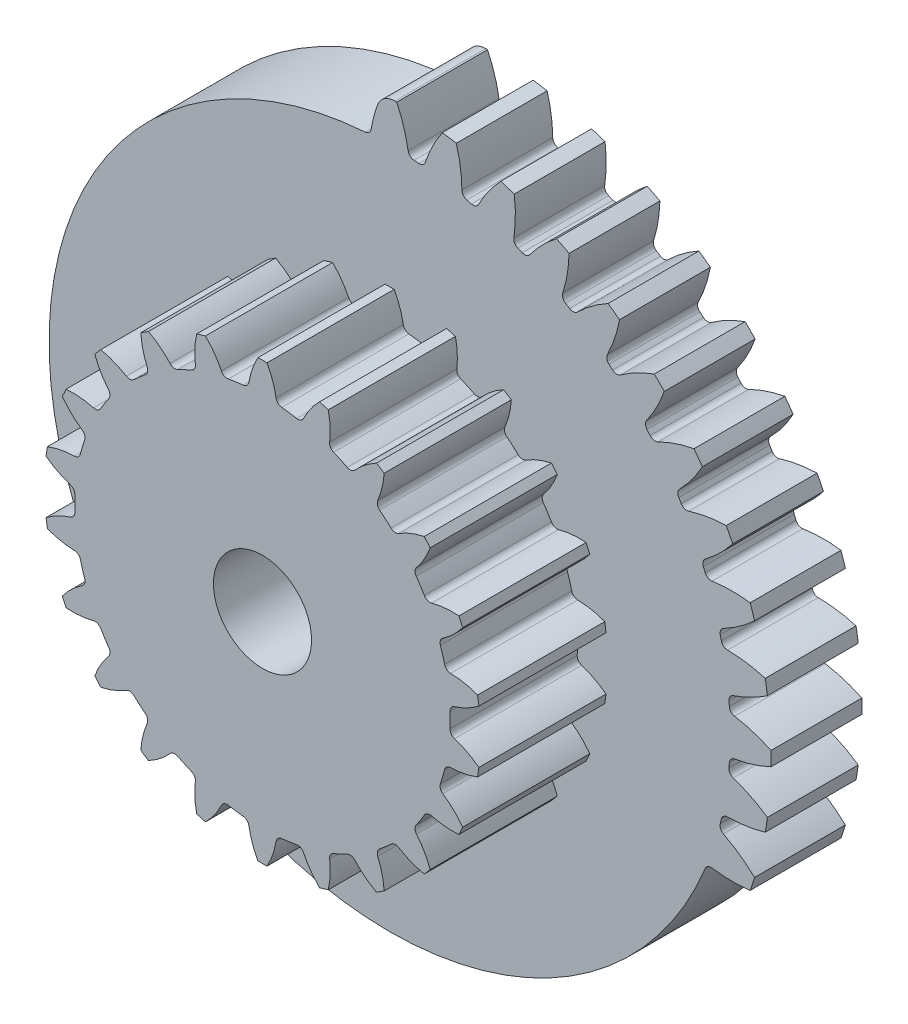
from build123d import *
from build123d.topology import SkipClean

# Parameters (mm, degrees)
ESQUISSE1_R                        = 1.15
BASE_EXTRUSION_DEPTH               = 2.5
BOSS_EXTRU_1_DEPTH                 = 5
CONG_1_R                           = 0.35
R_P_TITION_CIRCULAIRE4_COUNT       = 13
R_P_TITION_CIRCULAIRE4_ANGLE       = 108
CONG_1_OF_R_P_TITION_CIRCULAIRE4_R = 0.35
ENL_V_MAT_EXTRU_1_DEPTH            = 31.116440849
ENL_V_MAT_EXTRU_1_DEPTH_BACK       = 31.116440849
ESQUISSE4_R                        = 2.7
CONG_2_R                           = 1
BOSS_EXTRU_2_DEPTH                 = 5
BOSS_EXTRU_3_DEPTH                 = 7
R_P_TITION_START                   = 5
R_P_TITION_CIRCULAIRE6_DEPTH       = 7
ENL_V_MAT_EXTRU_2_REACH            = 32.511
ESQUISSE7_R                        = 2.7


# Read off the part's stored shape, not the designer's step: Répétition circulaire6
with BuildPart() as part:
    # Esquisse1 → Base-Extrusion (new body)
    with BuildSketch(Plane.XY):
        Circle(ESQUISSE1_R)
    extrude(amount=BASE_EXTRUSION_DEPTH)

    # Esquisse3 → Boss.-Extru.1 (add)
    with BuildSketch(Plane.XY):
        with BuildLine():
            Line((-1.6, 18.681608603), (0, 0))
            Line((0, 0), (1.6, 18.681608603))
            ThreePointArc((1.6, 18.681608603), (1.330138614, 18.702759991), (1.06, 18.720013355))
            ThreePointArc((1.06, 18.720013355), (0.815144271, 19.884727872), (0.39, 20.996378259))
            ThreePointArc((0.39, 20.996378259), (0, 21), (-0.39, 20.996378259))
            ThreePointArc((-0.39, 20.996378259), (-0.815144271, 19.884727872), (-1.06, 18.720013355))
            ThreePointArc((-1.06, 18.720013355), (-1.330138614, 18.702759991), (-1.6, 18.681608603))
        make_face()
    boss_extru_1 = extrude(amount=BOSS_EXTRU_1_DEPTH)

    # Congé1
    cong_1_edges = [part.edges().sort_by_distance(p)[0] for p in [
        (1.06, 18.720013355, 2.5),
        (-1.06, 18.720013355, 2.5),
    ]]
    fillet(cong_1_edges, radius=CONG_1_R)

    # Répétition circulaire4: Boss.-Extru.1 ×13 about axis
    r_p_tition_circulaire4_axis = Axis((0, 0, 0), (0, 0, -1))
    for i in range(1, R_P_TITION_CIRCULAIRE4_COUNT):
        add(boss_extru_1.rotate(r_p_tition_circulaire4_axis, i * R_P_TITION_CIRCULAIRE4_ANGLE / (R_P_TITION_CIRCULAIRE4_COUNT - 1)))

    # Congé1 of Répétition circulaire4
    cong_1_of_r_p_tition_circulaire4_edges = [part.edges().sort_by_distance(p)[0] for p in [
        (3.975404916, 18.323718393, 2.5),
        (1.881505634, 18.655359459, 2.5),
        (6.792922169, 17.476232672, 2.5),
        (4.776682354, 18.1313487, 2.5),
        (9.443175134, 16.198424102, 2.5),
        (7.554241302, 17.160883962, 2.5),
        (11.860905787, 14.521756571, 2.5),
        (10.145789759, 15.767861306, 2.5),
        (13.986581575, 12.487515199, 2.5),
        (12.487515199, 13.986581575, 2.5),
        (15.767861306, 10.145789759, 2.5),
        (14.521756571, 11.860905787, 2.5),
        (17.160883962, 7.554241302, 2.5),
        (16.198424102, 9.443175134, 2.5),
        (18.1313487, 4.776682354, 2.5),
        (17.476232672, 6.792922169, 2.5),
        (18.655359459, 1.881505634, 2.5),
        (18.323718393, 3.975404916, 2.5),
        (18.720013355, -1.06, 2.5),
        (18.720013355, 1.06, 2.5),
        (18.323718393, -3.975404916, 2.5),
        (18.655359459, -1.881505634, 2.5),
        (17.476232672, -6.792922169, 2.5),
        (18.1313487, -4.776682354, 2.5),
    ]]
    fillet(cong_1_of_r_p_tition_circulaire4_edges, radius=CONG_1_OF_R_P_TITION_CIRCULAIRE4_R)

    # Esquisse4 → Enlèv. mat.-Extru.1 (cut, two sides: drawn at the far end of the back side and taken through both)
    with BuildSketch(Plane.XY.offset(5).offset(-ENL_V_MAT_EXTRU_1_DEPTH_BACK)):
        Circle(ESQUISSE4_R)
    extrude(amount=ENL_V_MAT_EXTRU_1_DEPTH + ENL_V_MAT_EXTRU_1_DEPTH_BACK, mode=Mode.SUBTRACT)

    # Congé2
    cong_2_edges = [part.edges().sort_by_distance(p)[0] for p in [
        (-0.39, 20.996378259, 2.5),
    ]]
    fillet(cong_2_edges, radius=CONG_2_R)

    # Esquisse5 → Boss.-Extru.2 (add)
    with SkipClean():  # the faces are left unmerged after this step: merging them gives an invalid solid
        with BuildSketch(Plane(origin=(0, 0, 0), x_dir=(-1, 0, 0), z_dir=(0, 0, -1))):
            with BuildLine():
                Line((1.6, 18.681608603), (0.2304, 2.690151639))
                ThreePointArc((0.2304, 2.690151639), (2.184345885, -1.587020181), (-2.48728873, -1.050425995))
                Line((-2.48728873, -1.050425995), (-17.272838406, -7.294624967))
                ThreePointArc((-17.272838406, -7.294624967), (15.169068645, -11.02097348), (1.6, 18.681608603))
            make_face()
        extrude(amount=-BOSS_EXTRU_2_DEPTH)

    # Esquisse6 → Boss.-Extru.3 (add)
    with BuildSketch(Plane.XY.offset(5)):
        with BuildLine():
            Line((2.755166595, 9.960988005), (0, 0))
            Line((0, 0), (-1.282491053, 10.25511783))
            ThreePointArc((-1.282491053, 10.25511783), (-1.170717424, 10.268478257), (-1.058804905, 10.280620466))
            ThreePointArc((-1.058804905, 10.280620466), (-0.854826705, 10.373868903), (-0.749332414, 10.571791442))
            ThreePointArc((-0.749332414, 10.571791442), (-0.561514558, 11.307519234), (-0.25, 12))
            Line((-0.25, 12), (0.25, 12))
            ThreePointArc((0.25, 12), (0.561514558, 11.307519234), (0.749332414, 10.571791442))
            ThreePointArc((0.749332414, 10.571791442), (0.854826705, 10.373868903), (1.058804905, 10.280620466))
            ThreePointArc((1.058804905, 10.280620466), (1.913670786, 10.156283234), (2.755166595, 9.960988005))
        make_face()
    extrude(amount=BOSS_EXTRU_3_DEPTH)

    # Répétition circulaire6 outline → Répétition circulaire6 (add)
    with BuildSketch(Plane.XY.offset(R_P_TITION_START)):
        with BuildLine():
            ThreePointArc((-1.282491053, 10.25511783), (-1.582158452, 10.213177744), (-1.880469623, 10.162482915))
            ThreePointArc((-1.880469623, 10.162482915), (-2.102456393, 10.194486835), (-2.259438648, 10.354670944))
            ThreePointArc((-2.259438648, 10.354670944), (-2.646927032, 11.007682187), (-3.140917439, 11.584348823))
            Line((-3.140917439, 11.584348823), (-3.620663926, 11.443482544))
            ThreePointArc((-3.620663926, 11.443482544), (-3.724465579, 10.691288322), (-3.697397019, 9.93244827))
            ThreePointArc((-3.697397019, 9.93244827), (-3.742856827, 9.712821808), (-3.912301357, 9.565883289))
            ThreePointArc((-3.912301357, 9.565883289), (-4.293314159, 9.401046672), (-4.667399686, 9.221041436))
            ThreePointArc((-4.667399686, 9.221041436), (-4.889410978, 9.189208072), (-5.085163427, 9.298676587))
            ThreePointArc((-5.085163427, 9.298676587), (-5.640930336, 9.816068193), (-6.277376426, 10.230202598))
            Line((-6.277376426, 10.230202598), (-6.698003193, 9.95988219))
            ThreePointArc((-6.698003193, 9.95988219), (-6.585682548, 9.208912814), (-6.345920507, 8.48843721))
            ThreePointArc((-6.345920507, 8.48843721), (-6.327662949, 8.264899655), (-6.44884642, 8.076175138))
            ThreePointArc((-6.44884642, 8.076175138), (-6.767985685, 7.810671851), (-7.076204784, 7.53256602))
            ThreePointArc((-7.076204784, 7.53256602), (-7.280254564, 7.439474322), (-7.498918508, 7.489358755))
            ThreePointArc((-7.498918508, 7.489358755), (-8.177939012, 7.829214733), (-8.905279709, 8.047266201))
            Line((-8.905279709, 8.047266201), (-9.232710076, 7.669391414))
            ThreePointArc((-9.232710076, 7.669391414), (-8.913366684, 6.980485956), (-8.480335257, 6.35674345))
            ThreePointArc((-8.480335257, 6.35674345), (-8.399839451, 6.147404485), (-8.462944299, 5.932183308))
            ThreePointArc((-8.462944299, 5.932183308), (-8.694355262, 5.587522848), (-8.911737855, 5.233846903))
            ThreePointArc((-8.911737855, 5.233846903), (-9.081295223, 5.087038607), (-9.305155809, 5.073297618))
            ThreePointArc((-9.305155809, 5.073297618), (-10.052419706, 5.208084858), (-10.811730191, 5.212388155))
            Line((-10.811730191, 5.212388155), (-11.019437698, 4.757572157))
            ThreePointArc((-11.019437698, 4.757572157), (-10.518942861, 4.186541641), (-9.927723678, 3.710064141))
            ThreePointArc((-9.927723678, 3.710064141), (-9.791510916, 3.531883164), (-9.791424762, 3.307601266))
            ThreePointArc((-9.791424762, 3.307601266), (-9.916359882, 2.911705975), (-10.025294925, 2.511112637))
            ThreePointArc((-10.025294925, 2.511112637), (-10.146623351, 2.322481277), (-10.357544727, 2.246228079))
            ThreePointArc((-10.357544727, 2.246228079), (-11.112513139, 2.165026921), (-11.842278593, 1.95523342))
            Line((-11.842278593, 1.95523342), (-11.913436012, 1.460322699))
            ThreePointArc((-11.913436012, 1.460322699), (-11.272336846, 1.053428621), (-10.570826969, 0.762817499))
            ThreePointArc((-10.570826969, 0.762817499), (-10.3899324, 0.630229673), (-10.326662222, 0.415057041))
            ThreePointArc((-10.326662222, 0.415057041), (-10.335, 0), (-10.326662222, -0.415057041))
            ThreePointArc((-10.326662222, -0.415057041), (-10.3899324, -0.630229673), (-10.570826969, -0.762817499))
            ThreePointArc((-10.570826969, -0.762817499), (-11.272336846, -1.053428621), (-11.913436012, -1.460322699))
            Line((-11.913436012, -1.460322699), (-11.842278593, -1.95523342))
            ThreePointArc((-11.842278593, -1.95523342), (-11.112513139, -2.165026921), (-10.357544727, -2.246228079))
            ThreePointArc((-10.357544727, -2.246228079), (-10.146623351, -2.322481277), (-10.025294925, -2.511112637))
            ThreePointArc((-10.025294925, -2.511112637), (-9.916359882, -2.911705975), (-9.791424762, -3.307601266))
            ThreePointArc((-9.791424762, -3.307601266), (-9.791510916, -3.531883164), (-9.927723678, -3.710064141))
            ThreePointArc((-9.927723678, -3.710064141), (-10.518942861, -4.186541641), (-11.019437698, -4.757572157))
            Line((-11.019437698, -4.757572157), (-10.811730191, -5.212388155))
            ThreePointArc((-10.811730191, -5.212388155), (-10.052419706, -5.208084858), (-9.305155809, -5.073297618))
            ThreePointArc((-9.305155809, -5.073297618), (-9.081295223, -5.087038607), (-8.911737855, -5.233846903))
            ThreePointArc((-8.911737855, -5.233846903), (-8.694355262, -5.587522848), (-8.462944299, -5.932183308))
            ThreePointArc((-8.462944299, -5.932183308), (-8.399839451, -6.147404485), (-8.480335257, -6.35674345))
            ThreePointArc((-8.480335257, -6.35674345), (-8.913366684, -6.980485956), (-9.232710076, -7.669391414))
            Line((-9.232710076, -7.669391414), (-8.905279709, -8.047266201))
            ThreePointArc((-8.905279709, -8.047266201), (-8.177939012, -7.829214733), (-7.498918508, -7.489358755))
            ThreePointArc((-7.498918508, -7.489358755), (-7.280254564, -7.439474322), (-7.076204784, -7.53256602))
            ThreePointArc((-7.076204784, -7.53256602), (-6.767985685, -7.810671851), (-6.44884642, -8.076175138))
            ThreePointArc((-6.44884642, -8.076175138), (-6.327662949, -8.264899655), (-6.345920507, -8.48843721))
            ThreePointArc((-6.345920507, -8.48843721), (-6.585682548, -9.208912814), (-6.698003193, -9.95988219))
            Line((-6.698003193, -9.95988219), (-6.277376426, -10.230202598))
            ThreePointArc((-6.277376426, -10.230202598), (-5.640930336, -9.816068193), (-5.085163427, -9.298676587))
            ThreePointArc((-5.085163427, -9.298676587), (-4.889410978, -9.189208072), (-4.667399686, -9.221041436))
            ThreePointArc((-4.667399686, -9.221041436), (-4.293314159, -9.401046672), (-3.912301357, -9.565883289))
            ThreePointArc((-3.912301357, -9.565883289), (-3.742856827, -9.712821808), (-3.697397019, -9.93244827))
            ThreePointArc((-3.697397019, -9.93244827), (-3.724465579, -10.691288322), (-3.620663926, -11.443482544))
            Line((-3.620663926, -11.443482544), (-3.140917439, -11.584348823))
            ThreePointArc((-3.140917439, -11.584348823), (-2.646927032, -11.007682187), (-2.259438648, -10.354670944))
            ThreePointArc((-2.259438648, -10.354670944), (-2.102456393, -10.194486835), (-1.880469623, -10.162482915))
            ThreePointArc((-1.880469623, -10.162482915), (-1.470823854, -10.229804602), (-1.058804905, -10.280620466))
            ThreePointArc((-1.058804905, -10.280620466), (-0.854826705, -10.373868903), (-0.749332414, -10.571791442))
            ThreePointArc((-0.749332414, -10.571791442), (-0.561514558, -11.307519234), (-0.25, -12))
            Line((-0.25, -12), (0.25, -12))
            ThreePointArc((0.25, -12), (0.561514558, -11.307519234), (0.749332414, -10.571791442))
            ThreePointArc((0.749332414, -10.571791442), (0.854826705, -10.373868903), (1.058804905, -10.280620466))
            ThreePointArc((1.058804905, -10.280620466), (1.470823854, -10.229804602), (1.880469623, -10.162482915))
            ThreePointArc((1.880469623, -10.162482915), (2.102456393, -10.194486835), (2.259438648, -10.354670944))
            ThreePointArc((2.259438648, -10.354670944), (2.646927032, -11.007682187), (3.140917439, -11.584348823))
            Line((3.140917439, -11.584348823), (3.620663926, -11.443482544))
            ThreePointArc((3.620663926, -11.443482544), (3.724465579, -10.691288322), (3.697397019, -9.93244827))
            ThreePointArc((3.697397019, -9.93244827), (3.742856827, -9.712821808), (3.912301357, -9.565883289))
            ThreePointArc((3.912301357, -9.565883289), (4.293314159, -9.401046672), (4.667399686, -9.221041436))
            ThreePointArc((4.667399686, -9.221041436), (4.889410978, -9.189208072), (5.085163427, -9.298676587))
            ThreePointArc((5.085163427, -9.298676587), (5.640930336, -9.816068193), (6.277376426, -10.230202598))
            Line((6.277376426, -10.230202598), (6.698003193, -9.95988219))
            ThreePointArc((6.698003193, -9.95988219), (6.585682548, -9.208912814), (6.345920507, -8.48843721))
            ThreePointArc((6.345920507, -8.48843721), (6.327662949, -8.264899655), (6.44884642, -8.076175138))
            ThreePointArc((6.44884642, -8.076175138), (6.767985685, -7.810671851), (7.076204784, -7.53256602))
            ThreePointArc((7.076204784, -7.53256602), (7.280254564, -7.439474322), (7.498918508, -7.489358755))
            ThreePointArc((7.498918508, -7.489358755), (8.177939012, -7.829214733), (8.905279709, -8.047266201))
            Line((8.905279709, -8.047266201), (9.232710076, -7.669391414))
            ThreePointArc((9.232710076, -7.669391414), (8.913366684, -6.980485956), (8.480335257, -6.35674345))
            ThreePointArc((8.480335257, -6.35674345), (8.399839451, -6.147404485), (8.462944299, -5.932183308))
            ThreePointArc((8.462944299, -5.932183308), (8.694355262, -5.587522848), (8.911737855, -5.233846903))
            ThreePointArc((8.911737855, -5.233846903), (9.081295223, -5.087038607), (9.305155809, -5.073297618))
            ThreePointArc((9.305155809, -5.073297618), (10.052419706, -5.208084858), (10.811730191, -5.212388155))
            Line((10.811730191, -5.212388155), (11.019437698, -4.757572157))
            ThreePointArc((11.019437698, -4.757572157), (10.518942861, -4.186541641), (9.927723678, -3.710064141))
            ThreePointArc((9.927723678, -3.710064141), (9.791510916, -3.531883164), (9.791424762, -3.307601266))
            ThreePointArc((9.791424762, -3.307601266), (9.916359882, -2.911705975), (10.025294925, -2.511112637))
            ThreePointArc((10.025294925, -2.511112637), (10.146623351, -2.322481277), (10.357544727, -2.246228079))
            ThreePointArc((10.357544727, -2.246228079), (11.112513139, -2.165026921), (11.842278593, -1.95523342))
            Line((11.842278593, -1.95523342), (11.913436012, -1.460322699))
            ThreePointArc((11.913436012, -1.460322699), (11.272336846, -1.053428621), (10.570826969, -0.762817499))
            ThreePointArc((10.570826969, -0.762817499), (10.3899324, -0.630229673), (10.326662222, -0.415057041))
            ThreePointArc((10.326662222, -0.415057041), (10.335, 0), (10.326662222, 0.415057041))
            ThreePointArc((10.326662222, 0.415057041), (10.3899324, 0.630229673), (10.570826969, 0.762817499))
            ThreePointArc((10.570826969, 0.762817499), (11.272336846, 1.053428621), (11.913436012, 1.460322699))
            Line((11.913436012, 1.460322699), (11.842278593, 1.95523342))
            ThreePointArc((11.842278593, 1.95523342), (11.112513139, 2.165026921), (10.357544727, 2.246228079))
            ThreePointArc((10.357544727, 2.246228079), (10.146623351, 2.322481277), (10.025294925, 2.511112637))
            ThreePointArc((10.025294925, 2.511112637), (9.916359882, 2.911705975), (9.791424762, 3.307601266))
            ThreePointArc((9.791424762, 3.307601266), (9.791510916, 3.531883164), (9.927723678, 3.710064141))
            ThreePointArc((9.927723678, 3.710064141), (10.518942861, 4.186541641), (11.019437698, 4.757572157))
            Line((11.019437698, 4.757572157), (10.811730191, 5.212388155))
            ThreePointArc((10.811730191, 5.212388155), (10.052419706, 5.208084858), (9.305155809, 5.073297618))
            ThreePointArc((9.305155809, 5.073297618), (9.081295223, 5.087038607), (8.911737855, 5.233846903))
            ThreePointArc((8.911737855, 5.233846903), (8.694355262, 5.587522848), (8.462944299, 5.932183308))
            ThreePointArc((8.462944299, 5.932183308), (8.399839451, 6.147404485), (8.480335257, 6.35674345))
            ThreePointArc((8.480335257, 6.35674345), (8.913366684, 6.980485956), (9.232710076, 7.669391414))
            Line((9.232710076, 7.669391414), (8.905279709, 8.047266201))
            ThreePointArc((8.905279709, 8.047266201), (8.177939012, 7.829214733), (7.498918508, 7.489358755))
            ThreePointArc((7.498918508, 7.489358755), (7.280254564, 7.439474322), (7.076204784, 7.53256602))
            ThreePointArc((7.076204784, 7.53256602), (6.767985685, 7.810671851), (6.44884642, 8.076175138))
            ThreePointArc((6.44884642, 8.076175138), (6.327662949, 8.264899655), (6.345920507, 8.48843721))
            ThreePointArc((6.345920507, 8.48843721), (6.585682548, 9.208912814), (6.698003193, 9.95988219))
            Line((6.698003193, 9.95988219), (6.277376426, 10.230202598))
            ThreePointArc((6.277376426, 10.230202598), (5.640930336, 9.816068193), (5.085163427, 9.298676587))
            ThreePointArc((5.085163427, 9.298676587), (4.889410978, 9.189208072), (4.667399686, 9.221041436))
            ThreePointArc((4.667399686, 9.221041436), (4.293314159, 9.401046672), (3.912301357, 9.565883289))
            ThreePointArc((3.912301357, 9.565883289), (3.742856827, 9.712821808), (3.697397019, 9.93244827))
            ThreePointArc((3.697397019, 9.93244827), (3.724465579, 10.691288322), (3.620663926, 11.443482544))
            Line((3.620663926, 11.443482544), (3.140917439, 11.584348823))
            ThreePointArc((3.140917439, 11.584348823), (2.646927032, 11.007682187), (2.259438648, 10.354670944))
            ThreePointArc((2.259438648, 10.354670944), (2.102456393, 10.194486835), (1.880469623, 10.162482915))
            ThreePointArc((1.880469623, 10.162482915), (2.320006646, 10.07123598), (2.755166595, 9.960988005))
            Line((2.755166595, 9.960988005), (0, 0))
            Line((0, 0), (-1.282491053, 10.25511783))
        make_face()
    extrude(amount=R_P_TITION_CIRCULAIRE6_DEPTH)

    # Esquisse7 → Enlèv. mat.-Extru.2 (cut, up to next)
    with BuildSketch(Plane(origin=(0, 0, 5), x_dir=(-1, 0, 0), z_dir=(0, 0, -1)), mode=Mode.PRIVATE) as enl_v_mat_extru_2_sk1:
        with Locations(Location((0, 0, 0), (0, 0, 180))):
            Circle(ESQUISSE7_R)
    enl_v_mat_extru_2_tool1 = extrude(enl_v_mat_extru_2_sk1.sketch, amount=-ENL_V_MAT_EXTRU_2_REACH, mode=Mode.PRIVATE) & part.part
    add(enl_v_mat_extru_2_tool1.solids().sort_by_distance((0, 0, 5))[0], mode=Mode.SUBTRACT)


solid = part.part
